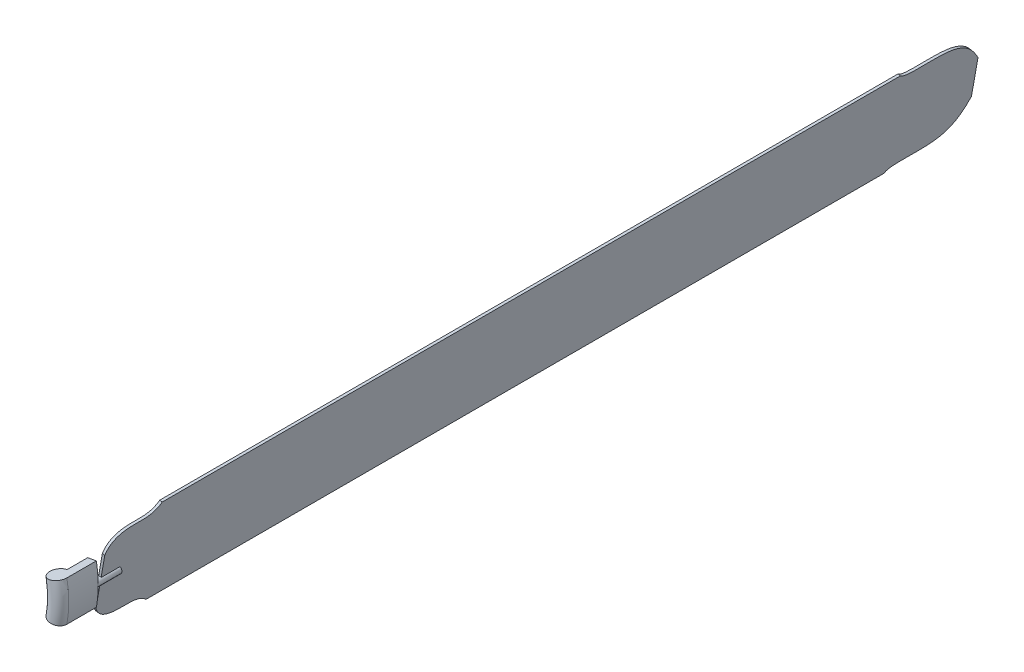
from build123d import *

# Parameters (mm, degrees)
REVOLVE_1_ANGLE          = 20
EXTRUDE_1_DEPTH          = 10
EXTRUDE_2_DEPTH          = 360
EXTRUDE_2_DEPTH_BACK     = 8
CUT_EXTRUDE_1_DEPTH      = 354.460525949
CUT_EXTRUDE_1_DEPTH_BACK = 354.460525949
CUT_EXTRUDE_2_DEPTH      = 354.460526061
CUT_EXTRUDE_2_DEPTH_BACK = 354.460526061


# Read off the part's stored shape, not the designer's step: 旋转1
with BuildPart() as part:
    # 旋转1 outline → 旋转1 (revolve)
    with BuildSketch(Plane(origin=(-4.145534285, 10.115302746, 0), x_dir=(0.9848077530122078, -0.17364817766693175, 0), z_dir=(-0.17364817766693175, -0.9848077530122078, 0))):
        with BuildLine():
            Line((48.69007377, 18.497782452), (48.69007377, 30.884801913))
            ThreePointArc((48.69007377, 30.884801913), (42.390721279, 33.49407915), (44.999998514, 27.194726658))
            Line((44.999998514, 27.194726658), (44.999998514, 18.497782452))
            Line((44.999998514, 18.497782452), (48.69007377, 18.497782452))
        make_face()
    revolve(axis=Axis((-4.145534285, 10.115302746, 0), (0, 0, 1)), revolution_arc=REVOLVE_1_ANGLE)

    # 草图2 → 凸台-拉伸1 (add)
    with BuildSketch(Plane(origin=(0, 0, 18.497782452), x_dir=(-1, 0, 0), z_dir=(0, 0, -1))):
        with BuildLine():
            Line((-43.804827858, 10.115302746), (-43.804827858, 8.790890094))
            ThreePointArc((-43.804827858, 8.790890094), (-42.230547682, 8.757264374), (-41.433540442, 10.115302746))
            Line((-41.433540442, 10.115302746), (-43.804827858, 10.115302746))
        make_face()
        with BuildLine():
            Line((-43.804827858, 11.439715397), (-43.804827858, 10.115302746))
            Line((-43.804827858, 10.115302746), (-41.433540442, 10.115302746))
            ThreePointArc((-41.433540442, 10.115302746), (-42.230547682, 11.473341118), (-43.804827858, 11.439715397))
        make_face()
        with BuildLine():
            ThreePointArc((-43.804827858, 11.439715397), (-44.544539485, 10.115302746), (-43.804827858, 8.790890094))
            Line((-43.804827858, 8.790890094), (-43.804827858, 10.115302746))
            Line((-43.804827858, 10.115302746), (-43.804827858, 11.439715397))
        make_face()
    extrude(amount=EXTRUDE_1_DEPTH)

    # 草图3 → 凸台-拉伸2 (add, two sides: drawn at the far end of the back side and taken through both)
    with BuildSketch(Plane(origin=(0, 0, 8.497782452), x_dir=(-1, 0, 0), z_dir=(0, 0, -1)).offset(-EXTRUDE_2_DEPTH_BACK)):
        Polygon((-45.891658823, 29.456257554), (-46.915436985, 29.275737842), (-40.047450695, -9.674547938), (-39.023672534, -9.494028226), align=None)
    extrude(amount=EXTRUDE_2_DEPTH + EXTRUDE_2_DEPTH_BACK)

    # 草图4 → 切除-拉伸1 (cut, two sides: drawn at the far end of the back side and taken through both)
    with BuildSketch(Plane(origin=(40.494317434, -7.140240729, 0), x_dir=(0, 0, -1), z_dir=(0.9848077530122087, -0.17364817766692764, 0)).offset(-CUT_EXTRUDE_1_DEPTH_BACK)):
        with BuildLine():
            Line((-16.497782452, 36.977753739), (-16.497782452, 27.931634297))
            add(Edge.make_bspline(
                [(-16.497782452, 27.931634297), (-15.119446691, 32.122246332), (-9.533617097, 34.35083792), (-2.34707738, 33.953128128), (2.582817502, 34.306427345), (5.20587008, 36.009348447), (6.100812574, 36.977753739)],
                knots=[0, 0, 0, 0, 0.299327733, 0.443712894, 0.582270155, 0.686413385, 0.686413385, 0.686413385, 0.686413385], degree=3))
            Line((6.100812574, 36.977753739), (-16.497782452, 36.977753739))
        make_face()
        with BuildLine():
            Line((-16.497782452, 6.472716459), (-16.497782452, -2.573402982))
            Line((-16.497782452, -2.573402982), (6.100812574, -2.573402982))
            add(Edge.make_bspline(
                [(-16.497782452, 6.472716459), (-15.119446691, 2.282104425), (-9.533617097, 0.053512837), (-2.34707738, 0.451222629), (2.582817502, 0.097923412), (5.20587008, -1.604997691), (6.100812574, -2.573402982)],
                knots=[0, 0, 0, 0, 0.299327733, 0.443712894, 0.582270155, 0.686413385, 0.686413385, 0.686413385, 0.686413385], degree=3))
        make_face()
    extrude(amount=CUT_EXTRUDE_1_DEPTH + CUT_EXTRUDE_1_DEPTH_BACK, mode=Mode.SUBTRACT)

    # 草图5 → 切除-拉伸2 (cut, two sides: drawn at the far end of the back side and taken through both)
    with BuildSketch(Plane(origin=(40.494317434, -7.140240729, 0), x_dir=(0, 0, -1), z_dir=(0.9848077530122087, -0.17364817766692764, 0)).offset(-CUT_EXTRUDE_2_DEPTH_BACK)):
        with BuildLine():
            Line((351.502217548, 36.977753739), (316.754779292, 36.977753739))
            add(Edge.make_bspline(
                [(351.502217548, 25.127512161), (347.967875432, 31.121714431), (339.410781642, 38.011527911), (319.00267796, 34.531851346), (316.754779292, 36.977753739)],
                knots=[0, 0, 0, 0, 0.348264384, 0.764472807, 0.764472807, 0.764472807, 0.764472807], degree=3))
            Line((351.502217548, 25.127512161), (351.502217548, 36.977753739))
        make_face()
        with BuildLine():
            Line((351.502217548, -2.573402982), (351.502217548, 9.276838596))
            add(Edge.make_bspline(
                [(351.502217548, 9.276838596), (347.967875432, 3.282636325), (339.410781642, -3.607177155), (319.00267796, -0.127500589), (316.754779292, -2.573402982)],
                knots=[0, 0, 0, 0, 0.348264384, 0.764472807, 0.764472807, 0.764472807, 0.764472807], degree=3))
            Line((316.754779292, -2.573402982), (351.502217548, -2.573402982))
        make_face()
    extrude(amount=CUT_EXTRUDE_2_DEPTH + CUT_EXTRUDE_2_DEPTH_BACK, mode=Mode.SUBTRACT)


solid = part.part
